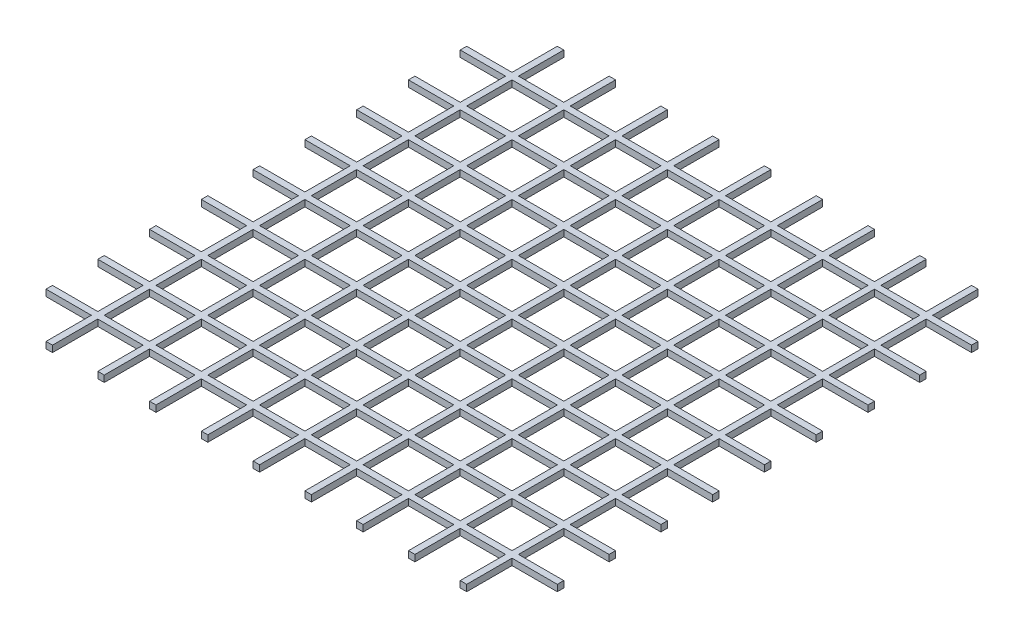
from build123d import *

# Parameters (mm, degrees)
SKETCH2_W           = 3.5
SKETCH2_H           = 3.5
BOSS_EXTRUDE4_DEPTH = 0.5


with BuildPart() as part:
    # Sketch2 → Boss-Extrude4 (new body)
    with BuildSketch(Plane(origin=(0, 0, 0), x_dir=(1, 0, 0), z_dir=(0, 1, 0))):
        Polygon((4.5, -4), (4.5, -0.5), (4, -0.5), (4, -4), (0.5, -4), (0.5, -4.5), (4, -4.5), (4, -8), (0.5, -8), (0.5, -8.5), (4, -8.5), (4, -12), (0.5, -12), (0.5, -12.5), (4, -12.5), (4, -16), (0.5, -16), (0.5, -16.5), (4, -16.5), (4, -20), (0.5, -20), (0.5, -20.5), (4, -20.5), (4, -24), (0.5, -24), (0.5, -24.5), (4, -24.5), (4, -28), (0.5, -28), (0.5, -28.5), (4, -28.5), (4, -32), (0.5, -32), (0.5, -32.5), (4, -32.5), (4, -36), (0.5, -36), (0.5, -36.5), (4, -36.5), (4, -40), (4.5, -40), (4.5, -36.5), (8, -36.5), (8, -40), (8.5, -40), (8.5, -36.5), (12, -36.5), (12, -40), (12.5, -40), (12.5, -36.5), (16, -36.5), (16, -40), (16.5, -40), (16.5, -36.5), (20, -36.5), (20, -40), (20.5, -40), (20.5, -36.5), (24, -36.5), (24, -40), (24.5, -40), (24.5, -36.5), (28, -36.5), (28, -40), (28.5, -40), (28.5, -36.5), (32, -36.5), (32, -40), (32.5, -40), (32.5, -36.5), (36, -36.5), (36, -40), (36.5, -40), (36.5, -36.5), (40, -36.5), (40, -36), (36.5, -36), (36.5, -32.5), (40, -32.5), (40, -32), (36.5, -32), (36.5, -28.5), (40, -28.5), (40, -28), (36.5, -28), (36.5, -24.5), (40, -24.5), (40, -24), (36.5, -24), (36.5, -20.5), (40, -20.5), (40, -20), (36.5, -20), (36.5, -16.5), (40, -16.5), (40, -16), (36.5, -16), (36.5, -12.5), (40, -12.5), (40, -12), (36.5, -12), (36.5, -8.5), (40, -8.5), (40, -8), (36.5, -8), (36.5, -4.5), (40, -4.5), (40, -4), (36.5, -4), (36.5, -0.5), (36, -0.5), (36, -4), (32.5, -4), (32.5, -0.5), (32, -0.5), (32, -4), (28.5, -4), (28.5, -0.5), (28, -0.5), (28, -4), (24.5, -4), (24.5, -0.5), (24, -0.5), (24, -4), (20.5, -4), (20.5, -0.5), (20, -0.5), (20, -4), (16.5, -4), (16.5, -0.5), (16, -0.5), (16, -4), (12.5, -4), (12.5, -0.5), (12, -0.5), (12, -4), (8.5, -4), (8.5, -0.5), (8, -0.5), (8, -4), align=None)
        with Locations((6.25, -34.25)):
            Rectangle(SKETCH2_W, SKETCH2_H, mode=Mode.SUBTRACT)
        with Locations((10.25, -34.25)):
            Rectangle(SKETCH2_W, SKETCH2_H, mode=Mode.SUBTRACT)
        with Locations((6.25, -30.25)):
            Rectangle(SKETCH2_W, SKETCH2_H, mode=Mode.SUBTRACT)
        with Locations((10.25, -30.25)):
            Rectangle(SKETCH2_W, SKETCH2_H, mode=Mode.SUBTRACT)
        with Locations((14.25, -34.25)):
            Rectangle(SKETCH2_W, SKETCH2_H, mode=Mode.SUBTRACT)
        with Locations((14.25, -30.25)):
            Rectangle(SKETCH2_W, SKETCH2_H, mode=Mode.SUBTRACT)
        with Locations((18.25, -34.25)):
            Rectangle(SKETCH2_W, SKETCH2_H, mode=Mode.SUBTRACT)
        with Locations((18.25, -30.25)):
            Rectangle(SKETCH2_W, SKETCH2_H, mode=Mode.SUBTRACT)
        with Locations((6.25, -26.25)):
            Rectangle(SKETCH2_W, SKETCH2_H, mode=Mode.SUBTRACT)
        with Locations((10.25, -26.25)):
            Rectangle(SKETCH2_W, SKETCH2_H, mode=Mode.SUBTRACT)
        with Locations((6.25, -22.25)):
            Rectangle(SKETCH2_W, SKETCH2_H, mode=Mode.SUBTRACT)
        with Locations((10.25, -22.25)):
            Rectangle(SKETCH2_W, SKETCH2_H, mode=Mode.SUBTRACT)
        with Locations((14.25, -26.25)):
            Rectangle(SKETCH2_W, SKETCH2_H, mode=Mode.SUBTRACT)
        with Locations((18.25, -26.25)):
            Rectangle(SKETCH2_W, SKETCH2_H, mode=Mode.SUBTRACT)
        with Locations((14.25, -22.25)):
            Rectangle(SKETCH2_W, SKETCH2_H, mode=Mode.SUBTRACT)
        with Locations((18.25, -22.25)):
            Rectangle(SKETCH2_W, SKETCH2_H, mode=Mode.SUBTRACT)
        with Locations((22.25, -34.25)):
            Rectangle(SKETCH2_W, SKETCH2_H, mode=Mode.SUBTRACT)
        with Locations((22.25, -30.25)):
            Rectangle(SKETCH2_W, SKETCH2_H, mode=Mode.SUBTRACT)
        with Locations((26.25, -34.25)):
            Rectangle(SKETCH2_W, SKETCH2_H, mode=Mode.SUBTRACT)
        with Locations((26.25, -30.25)):
            Rectangle(SKETCH2_W, SKETCH2_H, mode=Mode.SUBTRACT)
        with Locations((30.25, -34.25)):
            Rectangle(SKETCH2_W, SKETCH2_H, mode=Mode.SUBTRACT)
        with Locations((34.25, -34.25)):
            Rectangle(SKETCH2_W, SKETCH2_H, mode=Mode.SUBTRACT)
        with Locations((30.25, -30.25)):
            Rectangle(SKETCH2_W, SKETCH2_H, mode=Mode.SUBTRACT)
        with Locations((34.25, -30.25)):
            Rectangle(SKETCH2_W, SKETCH2_H, mode=Mode.SUBTRACT)
        with Locations((22.25, -26.25)):
            Rectangle(SKETCH2_W, SKETCH2_H, mode=Mode.SUBTRACT)
        with Locations((26.25, -26.25)):
            Rectangle(SKETCH2_W, SKETCH2_H, mode=Mode.SUBTRACT)
        with Locations((22.25, -22.25)):
            Rectangle(SKETCH2_W, SKETCH2_H, mode=Mode.SUBTRACT)
        with Locations((26.25, -22.25)):
            Rectangle(SKETCH2_W, SKETCH2_H, mode=Mode.SUBTRACT)
        with Locations((30.25, -26.25)):
            Rectangle(SKETCH2_W, SKETCH2_H, mode=Mode.SUBTRACT)
        with Locations((34.25, -26.25)):
            Rectangle(SKETCH2_W, SKETCH2_H, mode=Mode.SUBTRACT)
        with Locations((30.25, -22.25)):
            Rectangle(SKETCH2_W, SKETCH2_H, mode=Mode.SUBTRACT)
        with Locations((34.25, -22.25)):
            Rectangle(SKETCH2_W, SKETCH2_H, mode=Mode.SUBTRACT)
        with Locations((6.25, -18.25)):
            Rectangle(SKETCH2_W, SKETCH2_H, mode=Mode.SUBTRACT)
        with Locations((10.25, -18.25)):
            Rectangle(SKETCH2_W, SKETCH2_H, mode=Mode.SUBTRACT)
        with Locations((6.25, -14.25)):
            Rectangle(SKETCH2_W, SKETCH2_H, mode=Mode.SUBTRACT)
        with Locations((10.25, -14.25)):
            Rectangle(SKETCH2_W, SKETCH2_H, mode=Mode.SUBTRACT)
        with Locations((14.25, -18.25)):
            Rectangle(SKETCH2_W, SKETCH2_H, mode=Mode.SUBTRACT)
        with Locations((18.25, -18.25)):
            Rectangle(SKETCH2_W, SKETCH2_H, mode=Mode.SUBTRACT)
        with Locations((14.25, -14.25)):
            Rectangle(SKETCH2_W, SKETCH2_H, mode=Mode.SUBTRACT)
        with Locations((18.25, -14.25)):
            Rectangle(SKETCH2_W, SKETCH2_H, mode=Mode.SUBTRACT)
        with Locations((6.25, -10.25)):
            Rectangle(SKETCH2_W, SKETCH2_H, mode=Mode.SUBTRACT)
        with Locations((10.25, -10.25)):
            Rectangle(SKETCH2_W, SKETCH2_H, mode=Mode.SUBTRACT)
        with Locations((6.25, -6.25)):
            Rectangle(SKETCH2_W, SKETCH2_H, mode=Mode.SUBTRACT)
        with Locations((10.25, -6.25)):
            Rectangle(SKETCH2_W, SKETCH2_H, mode=Mode.SUBTRACT)
        with Locations((14.25, -10.25)):
            Rectangle(SKETCH2_W, SKETCH2_H, mode=Mode.SUBTRACT)
        with Locations((14.25, -6.25)):
            Rectangle(SKETCH2_W, SKETCH2_H, mode=Mode.SUBTRACT)
        with Locations((18.25, -10.25)):
            Rectangle(SKETCH2_W, SKETCH2_H, mode=Mode.SUBTRACT)
        with Locations((18.25, -6.25)):
            Rectangle(SKETCH2_W, SKETCH2_H, mode=Mode.SUBTRACT)
        with Locations((22.25, -18.25)):
            Rectangle(SKETCH2_W, SKETCH2_H, mode=Mode.SUBTRACT)
        with Locations((26.25, -18.25)):
            Rectangle(SKETCH2_W, SKETCH2_H, mode=Mode.SUBTRACT)
        with Locations((22.25, -14.25)):
            Rectangle(SKETCH2_W, SKETCH2_H, mode=Mode.SUBTRACT)
        with Locations((26.25, -14.25)):
            Rectangle(SKETCH2_W, SKETCH2_H, mode=Mode.SUBTRACT)
        with Locations((30.25, -18.25)):
            Rectangle(SKETCH2_W, SKETCH2_H, mode=Mode.SUBTRACT)
        with Locations((34.25, -18.25)):
            Rectangle(SKETCH2_W, SKETCH2_H, mode=Mode.SUBTRACT)
        with Locations((30.25, -14.25)):
            Rectangle(SKETCH2_W, SKETCH2_H, mode=Mode.SUBTRACT)
        with Locations((34.25, -14.25)):
            Rectangle(SKETCH2_W, SKETCH2_H, mode=Mode.SUBTRACT)
        with Locations((22.25, -10.25)):
            Rectangle(SKETCH2_W, SKETCH2_H, mode=Mode.SUBTRACT)
        with Locations((22.25, -6.25)):
            Rectangle(SKETCH2_W, SKETCH2_H, mode=Mode.SUBTRACT)
        with Locations((26.25, -10.25)):
            Rectangle(SKETCH2_W, SKETCH2_H, mode=Mode.SUBTRACT)
        with Locations((26.25, -6.25)):
            Rectangle(SKETCH2_W, SKETCH2_H, mode=Mode.SUBTRACT)
        with Locations((30.25, -10.25)):
            Rectangle(SKETCH2_W, SKETCH2_H, mode=Mode.SUBTRACT)
        with Locations((34.25, -10.25)):
            Rectangle(SKETCH2_W, SKETCH2_H, mode=Mode.SUBTRACT)
        with Locations((30.25, -6.25)):
            Rectangle(SKETCH2_W, SKETCH2_H, mode=Mode.SUBTRACT)
        with Locations((34.25, -6.25)):
            Rectangle(SKETCH2_W, SKETCH2_H, mode=Mode.SUBTRACT)
    extrude(amount=BOSS_EXTRUDE4_DEPTH)


solid = part.part
